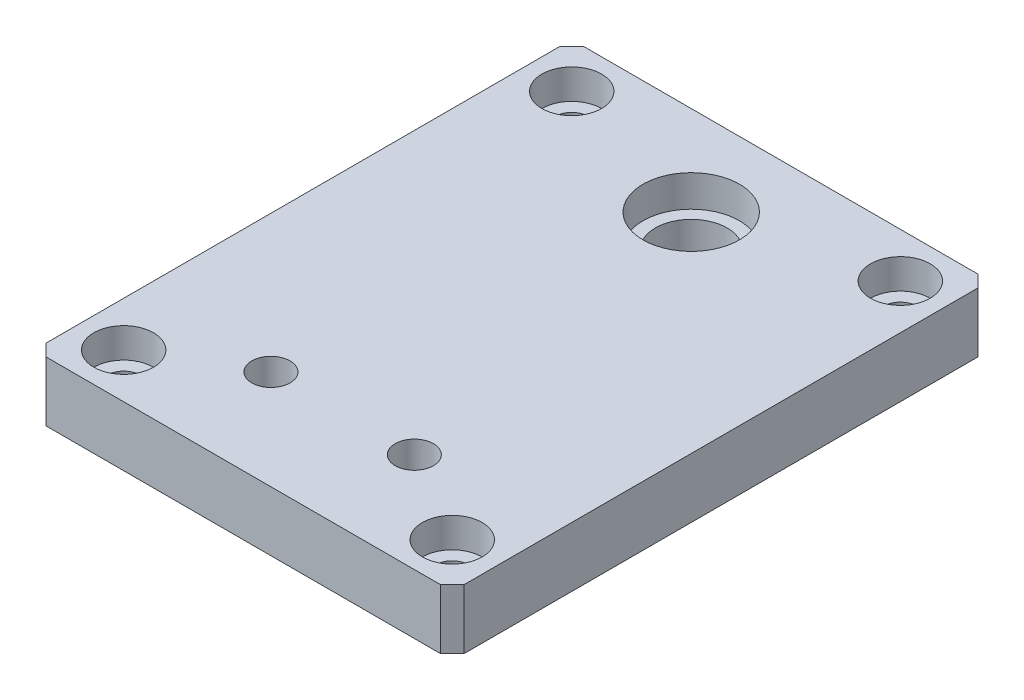
from build123d import *

# Parameters (mm, degrees)
SKETCH1_W                      = 70
SKETCH1_H                      = 90
BOSS_EXTRUDE1_DEPTH            = 10
CBORE_FOR_M5_SHCS1_D           = 5.5
CBORE_FOR_M5_SHCS1_CBORE_D     = 10
CBORE_FOR_M5_SHCS1_CBORE_DEPTH = 5
F_1_0MM_DOWEL_HOLE1_D          = 16.15
F_1_0MM_DOWEL_HOLE1_DEPTH      = 5.3
F_1_0MM_DOWEL_HOLE3_D          = 12
SKETCH14_R                     = 3.2
CUT_EXTRUDE1_DEPTH             = 58.879184514
CHAMFER1_SIZE                  = 2


with BuildPart() as part:
    # Sketch1 → Boss-Extrude1 (new body)
    with BuildSketch(Plane(origin=(0, 0, 0), x_dir=(1, 0, 0), z_dir=(0, 1, 0))):
        Rectangle(SKETCH1_W, SKETCH1_H)
    extrude(amount=BOSS_EXTRUDE1_DEPTH)

    # CBORE for M5 SHCS1 (through all)
    with Locations(Plane(origin=(0, 10, 0), x_dir=(1, 0, 0), z_dir=(0, 1, 0))):
        with Locations((-27.5, -37.5), (-27.5, 37.5), (27.5, 37.5), (27.5, -37.5)):
            CounterBoreHole(CBORE_FOR_M5_SHCS1_D / 2, CBORE_FOR_M5_SHCS1_CBORE_D / 2, CBORE_FOR_M5_SHCS1_CBORE_DEPTH)

    # Ø1.0mm Dowel Hole1
    with Locations(Plane(origin=(0, 10, 0), x_dir=(1, 0, 0), z_dir=(0, 1, 0))):
        with Locations((0, 30)):
            Hole(F_1_0MM_DOWEL_HOLE1_D / 2, depth=F_1_0MM_DOWEL_HOLE1_DEPTH)

    # Ø1.0mm Dowel Hole3 (through all)
    with Locations(Plane(origin=(0, 4.7, 0), x_dir=(1, 0, 0), z_dir=(0, 1, 0))):
        with Locations((0, 30)):
            Hole(F_1_0MM_DOWEL_HOLE3_D / 2)

    # Sketch14 → Cut-Extrude1 (cut, through all)
    with BuildSketch(Plane(origin=(0, 10, 0), x_dir=(1, 0, 0), z_dir=(0, 1, 0))):
        with Locations((12, -28.35)):
            Circle(SKETCH14_R)
        with Locations((-12, -28.35)):
            Circle(SKETCH14_R)
    extrude(amount=-CUT_EXTRUDE1_DEPTH, mode=Mode.SUBTRACT)

    # Chamfer1
    chamfer1_edges = [part.edges().sort_by_distance(p)[0] for p in [
        (35, 5, 45),
        (35, 5, -45),
        (-35, 5, -45),
        (-35, 5, 45),
    ]]
    chamfer(chamfer1_edges, length=CHAMFER1_SIZE)


solid = part.part
